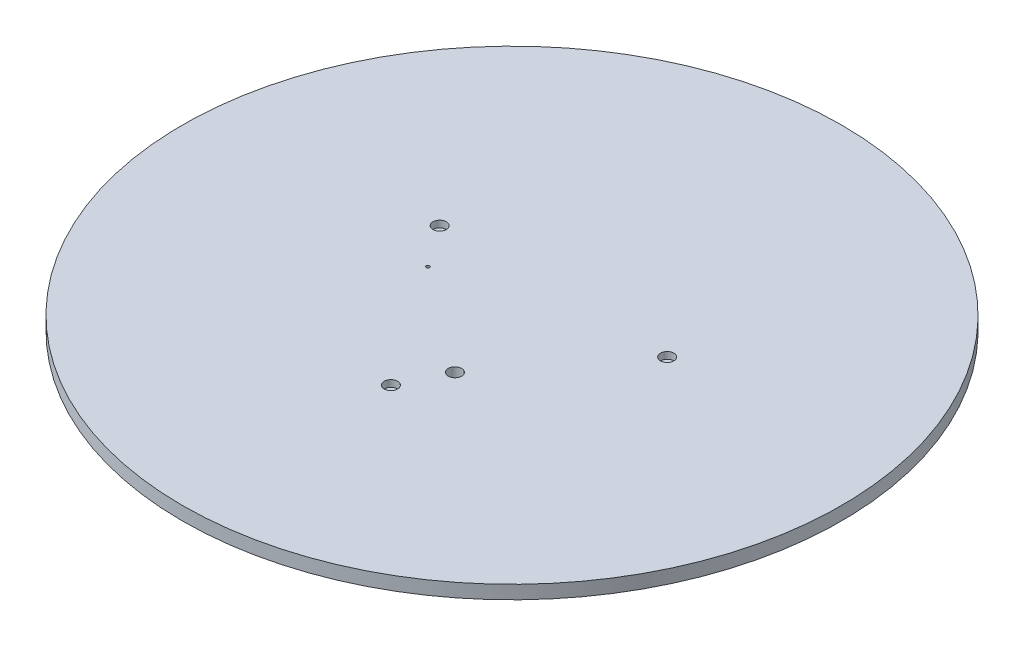
from build123d import *

# Parameters (mm, degrees)
SKETCH1_R               = 49
BOSS_EXTRUDE1_DEPTH     = 2
CUT_EXTRUDE1_DEPTH      = 70.32532005
CUT_EXTRUDE1_DEPTH_BACK = 70.32532005
SKETCH2_R               = 0.25
CUT_EXTRUDE2_DEPTH      = 70.32532005
CUT_EXTRUDE2_DEPTH_BACK = 70.32532005
SKETCH3_R               = 1
SKETCH4_R               = 1
CUT_EXTRUDE3_DEPTH      = 1


with BuildPart() as part:
    # Sketch1 → Boss-Extrude1 (new body)
    with BuildSketch(Plane(origin=(0, 0, 0), x_dir=(1, 0, 0), z_dir=(0, 1, 0))):
        Circle(SKETCH1_R)
    extrude(amount=BOSS_EXTRUDE1_DEPTH)

    # Sketch2 → Cut-Extrude1 (cut, two sides: drawn at the far end of the back side and taken through both)
    with BuildSketch(Plane(origin=(0, 2, 0), x_dir=(1, 0, 0), z_dir=(0, 1, 0)).offset(-CUT_EXTRUDE1_DEPTH_BACK)):
        with Locations((-12.5, 0)):
            Circle(SKETCH2_R)
    extrude(amount=CUT_EXTRUDE1_DEPTH + CUT_EXTRUDE1_DEPTH_BACK, mode=Mode.SUBTRACT)

    # Sketch3 → Cut-Extrude2 (cut, two sides: drawn at the far end of the back side and taken through both)
    with BuildSketch(Plane(origin=(0, 2, 0), x_dir=(1, 0, 0), z_dir=(0, 1, 0)).offset(-CUT_EXTRUDE2_DEPTH_BACK)):
        with Locations((3.105828541, -11.591109915)):
            Circle(SKETCH3_R)
    extrude(amount=CUT_EXTRUDE2_DEPTH + CUT_EXTRUDE2_DEPTH_BACK, mode=Mode.SUBTRACT)

    # Sketch4 → Cut-Extrude3 (cut)
    with BuildSketch(Plane(origin=(0, 2, 0), x_dir=(1, 0, 0), z_dir=(0, 1, 0))):
        with Locations((0, -18)):
            Circle(SKETCH4_R)
        with Locations((-16.914467174, 6.15636258)):
            Circle(SKETCH4_R)
        with Locations((16.914467174, 6.15636258)):
            Circle(SKETCH4_R)
    extrude(amount=-CUT_EXTRUDE3_DEPTH, mode=Mode.SUBTRACT)


solid = part.part
